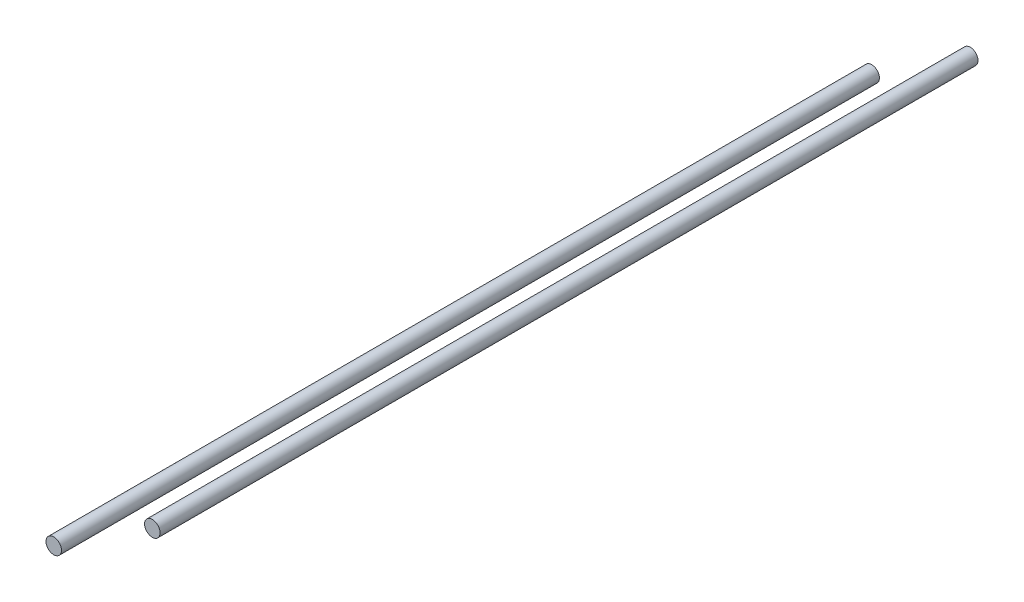
from build123d import *

# Parameters (mm, degrees)
BOSS_EXTRUDE1_START     = -335.28
BOSS_EXTRUDE1_OUTLINE_R = 3.175
BOSS_EXTRUDE1_DEPTH     = 335.28


# Read off the part's stored shape, not the designer's step: Boss-Extrude1
with BuildPart() as part:
    # Boss-Extrude1 outline → Boss-Extrude1 (new body)
    with BuildSketch(Plane.XY.offset(320.04).offset(BOSS_EXTRUDE1_START)):
        with Locations((-40.409844034, -26.400791933)):
            Circle(BOSS_EXTRUDE1_OUTLINE_R)
        Circle(BOSS_EXTRUDE1_OUTLINE_R)
    extrude(amount=BOSS_EXTRUDE1_DEPTH)


solid = part.part
